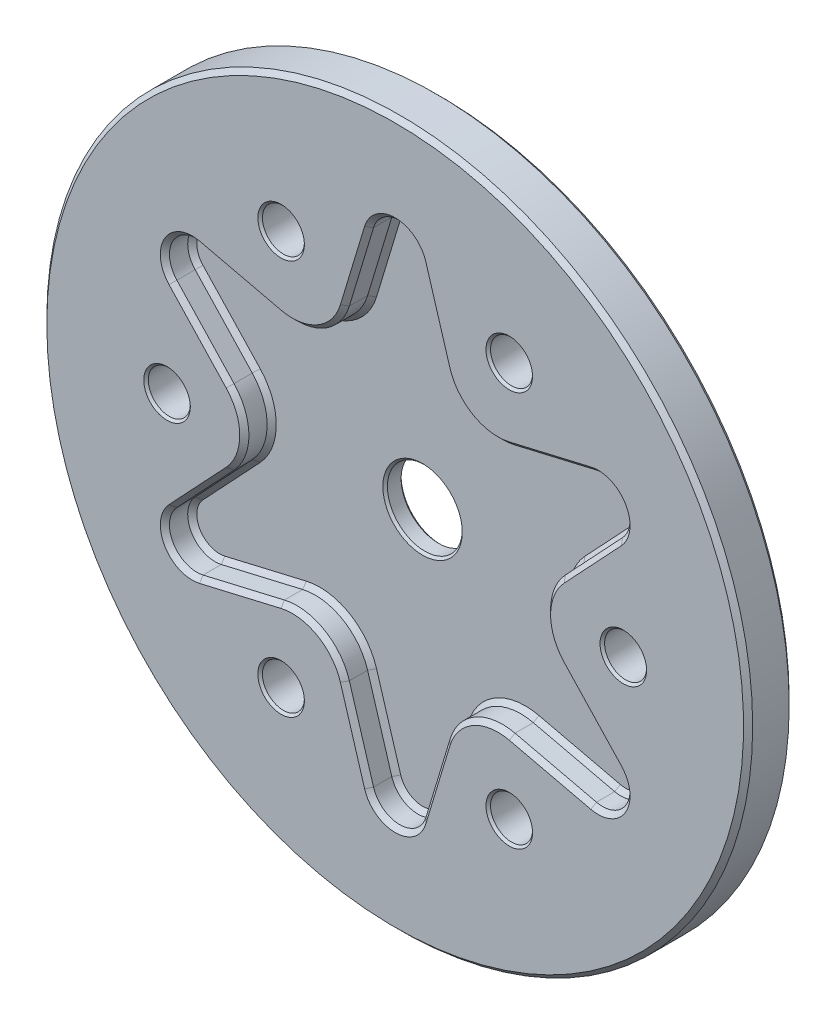
from build123d import *

# Parameters (mm, degrees)
SKETCH1_W           = 38.675
SKETCH1_H           = 5
SKETCH3_R           = 4.1
SKETCH3_R_2         = 2.3
CUT_EXTRUDE4_DEPTH  = 55.92277533
CHAMFER1_SIZE       = 0.5
CUT_EXTRUDE11_DEPTH = 3
CHAMFER2_SIZE       = 0.5
CHAMFER3_SIZE       = 0.25


with BuildPart() as part:
    # Sketch1 → Revolve1 (revolve)
    with BuildSketch(Plane(origin=(0, 0, 0), x_dir=(1, 0, 0), z_dir=(0, 1, 0))):
        with Locations((-19.3375, 2.5)):
            Rectangle(SKETCH1_W, SKETCH1_H)
    revolve(axis=Axis((0, 0, 0), (0, 0, -1)))

    # Sketch3 → Cut-Extrude4 (cut, through all)
    with BuildSketch(Plane(origin=(0, 0, 0), x_dir=(-1, 0, 0), z_dir=(0, 0, -1))):
        Circle(SKETCH3_R)
        with Locations((-12.5, 21.650635095)):
            Circle(SKETCH3_R_2)
        with Locations((12.5, 21.650635095)):
            Circle(SKETCH3_R_2)
        with Locations((25, 0)):
            Circle(SKETCH3_R_2)
        with Locations((12.5, -21.650635095)):
            Circle(SKETCH3_R_2)
        with Locations((-12.5, -21.650635095)):
            Circle(SKETCH3_R_2)
        with Locations((-25, 0)):
            Circle(SKETCH3_R_2)
    extrude(amount=CUT_EXTRUDE4_DEPTH, mode=Mode.SUBTRACT)

    # Chamfer1
    chamfer1_edges = [part.edges().sort_by_distance(p)[0] for p in [
        (38.675, 0, 0),
        (38.675, 0, -5),
    ]]
    chamfer(chamfer1_edges, length=CHAMFER1_SIZE)

    # Sketch14 → Cut-Extrude11 (cut)
    with BuildSketch(Plane.XY):
        with BuildLine():
            Line((-2.871572225, 26.543373742), (-5.522750274, 17.77635457))
            ThreePointArc((-5.522750274, 17.77635457), (-6.564563598, 15.785168894), (-8.265894724, 14.316949631))
            ThreePointArc((-8.265894724, 14.316949631), (-10.388075466, 13.577663288), (-12.633399507, 13.67101932))
            Line((-12.633399507, 13.67101932), (-21.55144985, 15.758541367))
            ThreePointArc((-21.55144985, 15.758541367), (-24.833278454, 14.3375), (-24.423022075, 10.784832375))
            Line((-24.423022075, 10.784832375), (-18.156149781, 4.105335249))
            ThreePointArc((-18.156149781, 4.105335249), (-16.952639064, 2.207505606), (-16.531789447, 0))
            ThreePointArc((-16.531789447, 0), (-16.952639064, -2.207505606), (-18.156149781, -4.105335249))
            Line((-18.156149781, -4.105335249), (-24.423022075, -10.784832375))
            ThreePointArc((-24.423022075, -10.784832375), (-24.833278454, -14.3375), (-21.55144985, -15.758541367))
            Line((-21.55144985, -15.758541367), (-12.633399507, -13.67101932))
            ThreePointArc((-12.633399507, -13.67101932), (-10.388075466, -13.577663288), (-8.265894724, -14.316949631))
            ThreePointArc((-8.265894724, -14.316949631), (-6.564563598, -15.785168894), (-5.522750274, -17.77635457))
            Line((-5.522750274, -17.77635457), (-2.871572225, -26.543373742))
            ThreePointArc((-2.871572225, -26.543373742), (0, -28.675), (2.871572225, -26.543373742))
            Line((2.871572225, -26.543373742), (5.522750274, -17.77635457))
            ThreePointArc((5.522750274, -17.77635457), (6.564563598, -15.785168894), (8.265894724, -14.316949631))
            ThreePointArc((8.265894724, -14.316949631), (10.388075466, -13.577663288), (12.633399507, -13.67101932))
            Line((12.633399507, -13.67101932), (21.55144985, -15.758541367))
            ThreePointArc((21.55144985, -15.758541367), (24.833278454, -14.3375), (24.423022075, -10.784832375))
            Line((24.423022075, -10.784832375), (18.156149781, -4.105335249))
            ThreePointArc((18.156149781, -4.105335249), (16.952639064, -2.207505606), (16.531789447, 0))
            ThreePointArc((16.531789447, 0), (16.952639064, 2.207505606), (18.156149781, 4.105335249))
            Line((18.156149781, 4.105335249), (24.423022075, 10.784832375))
            ThreePointArc((24.423022075, 10.784832375), (24.833278454, 14.3375), (21.55144985, 15.758541367))
            Line((21.55144985, 15.758541367), (12.633399507, 13.67101932))
            ThreePointArc((12.633399507, 13.67101932), (10.388075466, 13.577663288), (8.265894724, 14.316949631))
            ThreePointArc((8.265894724, 14.316949631), (6.564563598, 15.785168894), (5.522750274, 17.77635457))
            Line((5.522750274, 17.77635457), (2.871572225, 26.543373742))
            ThreePointArc((2.871572225, 26.543373742), (0, 28.675), (-2.871572225, 26.543373742))
        make_face()
    extrude(amount=-CUT_EXTRUDE11_DEPTH, mode=Mode.SUBTRACT)

    # Chamfer2
    chamfer2_edges = [part.edges().sort_by_distance(p)[0] for p in [
        (21.289585928, -7.445083812, 0),
        (16.531789447, 0, 0),
        (24.833278454, -14.3375, 0),
        (21.289585928, 7.445083812, 0),
        (17.092424679, -14.714780344, 0),
        (24.833278454, 14.3375, 0),
        (8.265894724, -14.316949631, 0),
        (17.092424679, 14.714780344, 0),
        (4.197161249, -22.159864156, 0),
        (8.265894724, 14.316949631, 0),
        (0, -28.675, 0),
        (4.197161249, 22.159864156, 0),
        (-4.197161249, -22.159864156, 0),
        (0, 28.675, 0),
        (-8.265894724, -14.316949631, 0),
        (-4.197161249, 22.159864156, 0),
        (-17.092424679, -14.714780344, 0),
        (-8.265894724, 14.316949631, 0),
        (-24.833278454, -14.3375, 0),
        (-17.092424679, 14.714780344, 0),
        (-21.289585928, -7.445083812, 0),
        (-24.833278454, 14.3375, 0),
        (-16.531789447, 0, 0),
        (-21.289585928, 7.445083812, 0),
        (8.265894724, -14.316949631, -3),
        (17.092424679, -14.714780344, -3),
        (4.197161249, -22.159864156, -3),
        (24.833278454, -14.3375, -3),
        (0, -28.675, -3),
        (21.289585928, -7.445083812, -3),
        (-4.197161249, -22.159864156, -3),
        (16.531789447, 0, -3),
        (-8.265894724, -14.316949631, -3),
        (21.289585928, 7.445083812, -3),
        (-17.092424679, -14.714780344, -3),
        (24.833278454, 14.3375, -3),
        (-24.833278454, -14.3375, -3),
        (17.092424679, 14.714780344, -3),
        (-21.289585928, -7.445083812, -3),
        (8.265894724, 14.316949631, -3),
        (-16.531789447, 0, -3),
        (4.197161249, 22.159864156, -3),
        (-21.289585928, 7.445083812, -3),
        (0, 28.675, -3),
        (-24.833278454, 14.3375, -3),
        (-4.197161249, 22.159864156, -3),
        (-17.092424679, 14.714780344, -3),
        (-8.265894724, 14.316949631, -3),
    ]]
    chamfer(chamfer2_edges, length=CHAMFER2_SIZE)

    # Chamfer3
    chamfer3_edges = [part.edges().sort_by_distance(p)[0] for p in [
        (4.1, 0, -5),
        (4.1, 0, -3),
        (-10.2, -21.650635095, 0),
        (-10.2, -21.650635095, -5),
        (14.8, -21.650635095, 0),
        (14.8, -21.650635095, -5),
        (27.3, 0, 0),
        (27.3, 0, -5),
        (14.8, 21.650635095, 0),
        (14.8, 21.650635095, -5),
        (-10.2, 21.650635095, 0),
        (-10.2, 21.650635095, -5),
        (-22.7, 0, 0),
        (-22.7, 0, -5),
    ]]
    chamfer(chamfer3_edges, length=CHAMFER3_SIZE)


solid = part.part
